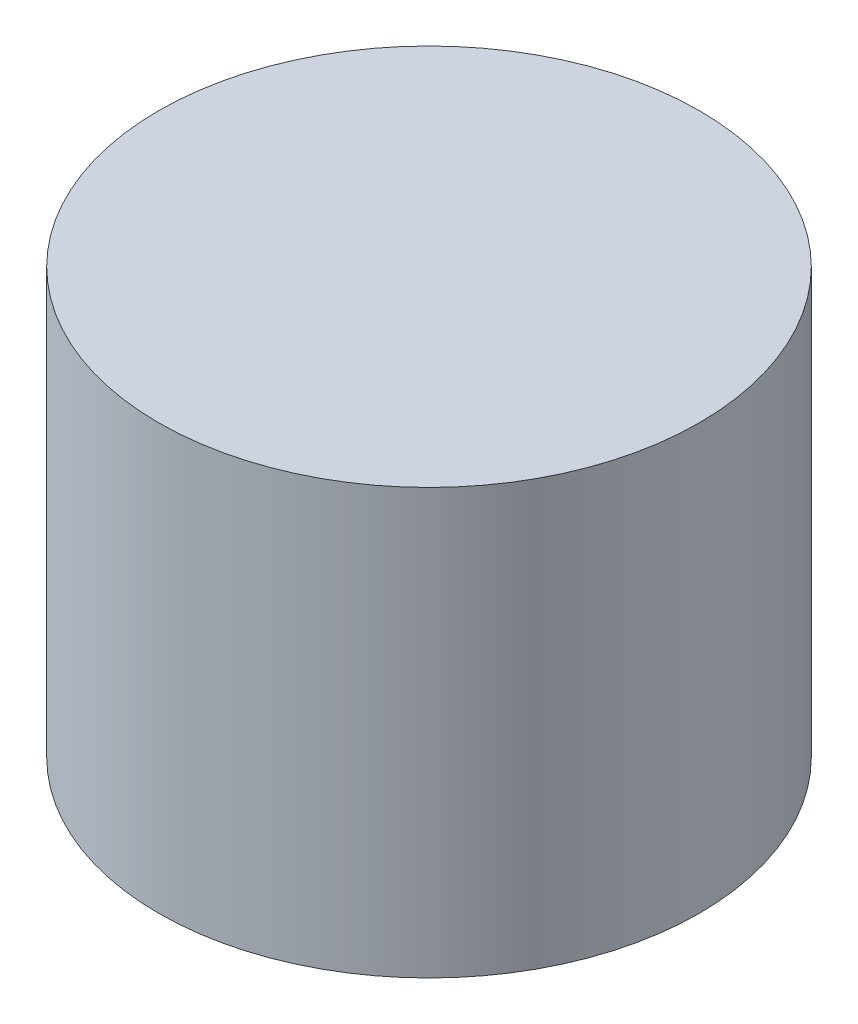
from build123d import *

# Parameters (mm, degrees)
SKETCH1_R           = 35
BOSS_EXTRUDE1_DEPTH = 55


with BuildPart() as part:
    # Sketch1 → Boss-Extrude1 (new body)
    with BuildSketch(Plane(origin=(0, 0, 0), x_dir=(1, 0, 0), z_dir=(0, 1, 0))):
        Circle(SKETCH1_R)
    extrude(amount=BOSS_EXTRUDE1_DEPTH)


solid = part.part
